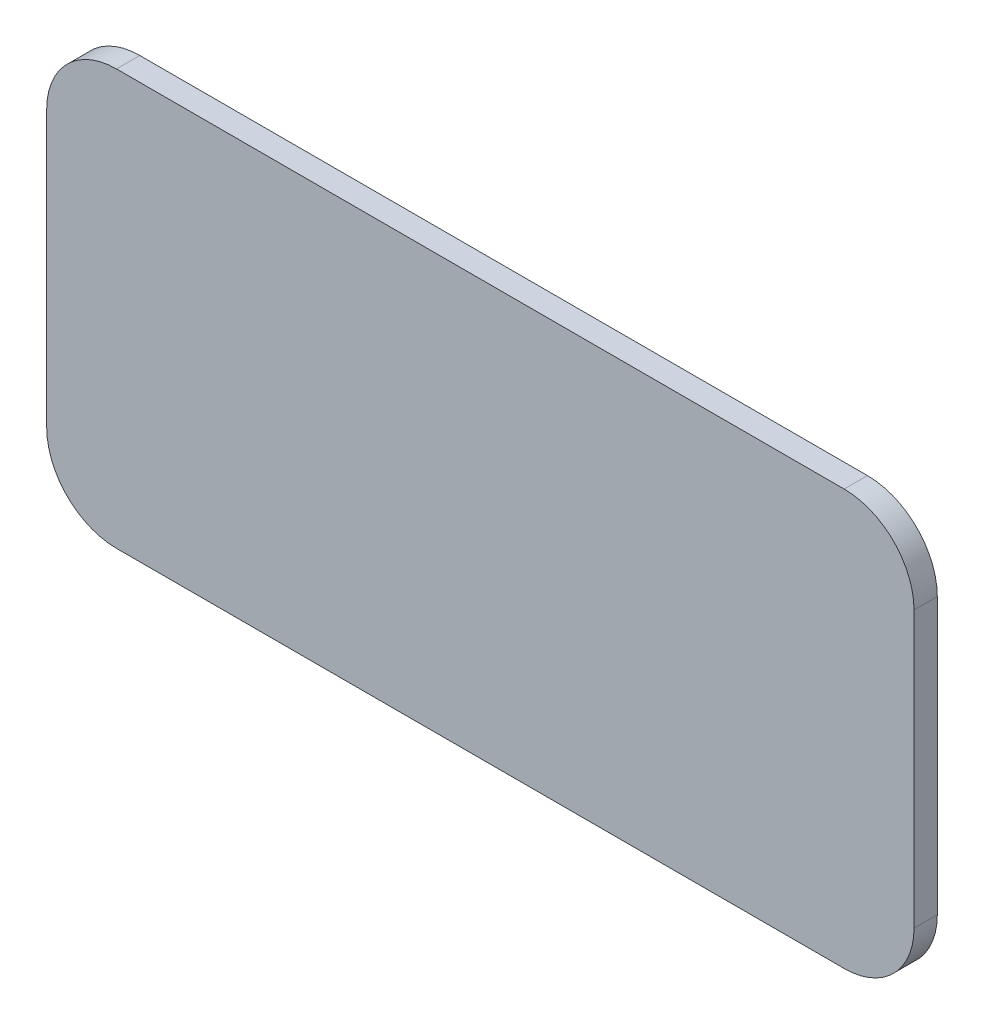
from build123d import *

# Parameters (mm, degrees)
BOSS_EXTRUDE1_DEPTH = 6


with BuildPart() as part:
    # Sketch1 → Boss-Extrude1 (new body)
    with BuildSketch(Plane.XY):
        with BuildLine():
            Line((-62.991811867, 96), (-250.5, 96))
            ThreePointArc((-250.5, 96), (-263.227922061, 90.727922061), (-268.5, 78))
            Line((-268.5, 78), (-268.5, 7))
            ThreePointArc((-268.5, 7), (-263.227922061, -5.727922061), (-250.5, -11))
            Line((-250.5, -11), (-62.991811867, -11))
            ThreePointArc((-62.991811867, -11), (-50.263889805, -5.727922061), (-44.991811867, 7))
            Line((-44.991811867, 7), (-44.991811867, 78))
            ThreePointArc((-44.991811867, 78), (-50.263889805, 90.727922061), (-62.991811867, 96))
        make_face()
    extrude(amount=BOSS_EXTRUDE1_DEPTH)


solid = part.part
